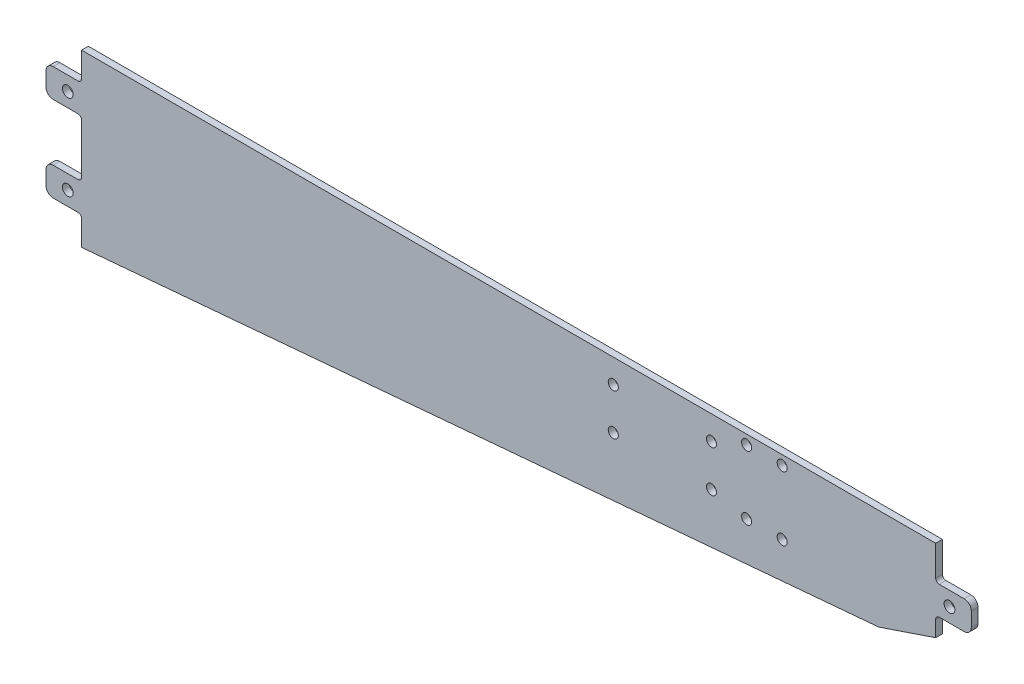
from build123d import *

# Parameters (mm, degrees)
SKETCH1_W                  = 381
SKETCH1_H                  = 76.2
BOSS_EXTRUDE1_DEPTH        = 1.5
CUT_EXTRUDE1_DEPTH         = 195.29580541
SKETCH3_W                  = 15.875
SKETCH3_H                  = 12.7
BOSS_EXTRUDE2_DEPTH        = 3
FILLET1_R                  = 3.175
MIRROR1_START              = -1.5
MIRROR1_DEPTH              = 3
FILLET3_R                  = 1.5875
FILLET4_R                  = 3.175
F_8_CLEARANCE_HOLE1_D      = 4.4958
F_4_8_4_8_DIAMETER_HOLE1_D = 4.8
CUT_EXTRUDE2_DEPTH         = 210.883897965


# Read off the part's stored shape, not the designer's step: Mirror1
with BuildPart() as part:
    # Sketch1 → Boss-Extrude1 (new, symmetric)
    with BuildSketch(Plane.XY):
        Rectangle(SKETCH1_W, SKETCH1_H)
    extrude(amount=BOSS_EXTRUDE1_DEPTH, both=True)

    # Sketch5 → Cut-Extrude1 (cut, through all)
    with BuildSketch(Plane.XY.offset(1.5)):
        Polygon((-190.5, -38.1), (190.5, -4.766819197), (190.5, -38.1), align=None)
    extrude(amount=-CUT_EXTRUDE1_DEPTH, mode=Mode.SUBTRACT)

    # Sketch3 → Boss-Extrude2 (add)
    with BuildSketch(Plane.XY.offset(1.5)):
        with Locations((-198.4375, -19.05)):
            Rectangle(SKETCH3_W, SKETCH3_H)
        with Locations((198.4375, 16.666590402)):
            Rectangle(SKETCH3_W, SKETCH3_H)
    extrude(amount=-BOSS_EXTRUDE2_DEPTH)

    # Fillet1
    fillet1_edges = [part.edges().sort_by_distance(p)[0] for p in [
        (-206.375, -12.7, 0),
        (-206.375, -25.4, 0),
    ]]
    fillet(fillet1_edges, radius=FILLET1_R)

    # Mirror1 outline → Mirror1 (add)
    with BuildSketch(Plane.XY.offset(MIRROR1_START)):
        with BuildLine():
            Line((-206.375, 22.225), (-206.375, 15.875))
            ThreePointArc((-206.375, 15.875), (-205.44506403, 13.62993597), (-203.2, 12.7))
            Line((-203.2, 12.7), (-190.5, 12.7))
            Line((-190.5, 12.7), (-190.5, 25.4))
            Line((-190.5, 25.4), (-203.2, 25.4))
            ThreePointArc((-203.2, 25.4), (-205.44506403, 24.47006403), (-206.375, 22.225))
        make_face()
    extrude(amount=MIRROR1_DEPTH)

    # Fillet3
    fillet3_edges = [part.edges().sort_by_distance(p)[0] for p in [
        (190.5, 10.316590402, 0),
        (190.5, 23.016590402, 0),
        (-190.5, -25.4, 0),
        (-190.5, -12.7, 0),
        (-190.5, 25.4, 0),
        (-190.5, 12.7, 0),
    ]]
    fillet(fillet3_edges, radius=FILLET3_R)

    # Fillet4
    fillet4_edges = [part.edges().sort_by_distance(p)[0] for p in [
        (206.375, 23.016590402, 0),
        (206.375, 10.316590402, 0),
    ]]
    fillet(fillet4_edges, radius=FILLET4_R)

    # #8 Clearance Hole1 (through all)
    with Locations(Plane(origin=(0, 0, -1.5), x_dir=(-1, 0, 0), z_dir=(0, 0, -1))):
        with Locations((-46.681846327, 8.89), (-46.681846327, 27.432641431), (-90.478153673, 27.432641431), (-90.478153673, 8.89), (-106.1525, 33.896326852), (-122.0275, 33.896326852), (-122.0275, 5.321326852), (-106.1525, 5.321326852)):
            Hole(F_8_CLEARANCE_HOLE1_D / 2)

    # Ø4.8 (4.8) Diameter Hole1 (through all)
    with Locations(Plane.XY.offset(1.5)):
        with Locations((-196.65, 19.05), (-196.65, -19.05), (196.65, 16.666590402)):
            Hole(F_4_8_4_8_DIAMETER_HOLE1_D / 2)

    # Sketch12 → Cut-Extrude2 (cut, through all)
    with BuildSketch(Plane.XY.offset(1.5)):
        Polygon((190.5, -4.766819197), (165.1, -6.98903125), (190.5, 1.583180803), align=None)
    extrude(amount=-CUT_EXTRUDE2_DEPTH, mode=Mode.SUBTRACT)


solid = part.part
